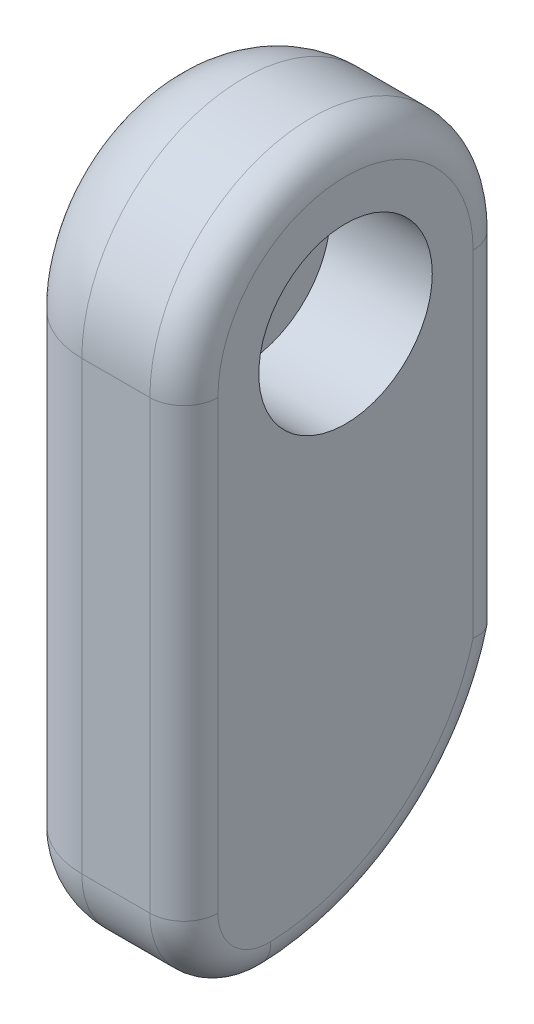
from build123d import *

# Parameters (mm, degrees)
ESBO_O1_R                = 9.5
RESSALTO_EXTRUS_O1_DEPTH = 11
FILETE1_R                = 5
ESBO_O2_R                = 5.1000000000000005
CORTE_EXTRUS_O1_DEPTH    = 6
FILETE2_R                = 5
FILETE4_R                = 2


with BuildPart() as part:
    # Esboço1 → Ressalto-extrusão1 (new body)
    with BuildSketch(Plane(origin=(0, 0, 0), x_dir=(0, 0, -1), z_dir=(1, 0, 0))):
        Circle(ESBO_O1_R)
        with BuildLine():
            Line((9.500000000000002, -20), (9.5, 0))
            ThreePointArc((9.5, -2.33e-15), (-1.75e-15, -9.5), (-9.5, 1.16e-15))
            Line((-9.5, 0), (-9.5, -30.5))
            ThreePointArc((-9.5, -30.5), (2.298839010018332, -29.40980392289032), (9.5, -20))
        make_face()
    extrude(amount=-RESSALTO_EXTRUS_O1_DEPTH)

    # Filete1
    filete1_edges = [part.edges().sort_by_distance(p)[0] for p in [
        (-5.5, -30.5, 9.5),
    ]]
    fillet(filete1_edges, radius=FILETE1_R)

    # Esboço2 → Corte-extrusão1 (cut)
    with BuildSketch(Plane(origin=(0, 0, 0), x_dir=(0, 0, -1), z_dir=(1, 0, 0))):
        Circle(ESBO_O2_R)
    extrude(amount=-CORTE_EXTRUS_O1_DEPTH, mode=Mode.SUBTRACT)

    # Filete2
    # the kernel refuses this fillet: 5 mm, written as the material it takes off along each edge
    with BuildSketch(Plane(origin=(-11, -16.482034889709183, 4.845454403055449), x_dir=(0, -0.9993747520623889, -0.035356823107268454), z_dir=(0, -0.035356823107268454, 0.9993747520623889))) as filete2_piece_1:
        with BuildLine():
            CenterArc((14.770515920148714 - FILETE2_R, FILETE2_R), FILETE2_R, 270, 90)
            Line((14.770515920148714 - FILETE2_R, 0), (14.770515920148714 - FILETE2_R, -FILETE2_R * 0.02))
            Line((14.770515920148714 - FILETE2_R, -FILETE2_R * 0.02), (14.770515920148714 + FILETE2_R * 0.02, -FILETE2_R * 0.02))
            Line((14.770515920148714 + FILETE2_R * 0.02, -FILETE2_R * 0.02), (14.770515920148714 + FILETE2_R * 0.02, FILETE2_R))
            Line((14.770515920148714 + FILETE2_R * 0.02, FILETE2_R), (14.770515920148714, FILETE2_R))
        make_face()
    revolve(axis=Axis((-11, -16.482034889709183, 4.845454403055449), (1, 0, 0)), revolution_arc=93.59555420647537, mode=Mode.SUBTRACT)
    with BuildSketch(Plane(origin=(-11, -25, -9.500000000000002), x_dir=(1, 0, 0), z_dir=(0, 1, 9e-17))) as filete2_piece_2:
        with BuildLine():
            CenterArc((FILETE2_R, -FILETE2_R), FILETE2_R, 90, 90)
            Line((0, -FILETE2_R), (-FILETE2_R * 0.02, -FILETE2_R))
            Line((-FILETE2_R * 0.02, -FILETE2_R), (-FILETE2_R * 0.02, FILETE2_R * 0.02))
            Line((-FILETE2_R * 0.02, FILETE2_R * 0.02), (FILETE2_R, FILETE2_R * 0.02))
            Line((FILETE2_R, FILETE2_R * 0.02), (FILETE2_R, 0))
        make_face()
    extrude(amount=25, mode=Mode.SUBTRACT)
    with BuildSketch(Plane(origin=(-11, -26.246441814929426, 4.5), x_dir=(0, 0, 1), z_dir=(0, 1, 0))) as filete2_piece_3:
        with BuildLine():
            CenterArc((5 - FILETE2_R, FILETE2_R), FILETE2_R, 270, 90)
            Line((5 - FILETE2_R, 0), (5 - FILETE2_R, -FILETE2_R * 0.02))
            Line((5 - FILETE2_R, -FILETE2_R * 0.02), (5, -FILETE2_R * 0.02))
            Line((5, -FILETE2_R * 0.02), (5 + FILETE2_R * 0.02, 0))
            Line((5 + FILETE2_R * 0.02, 0), (5 + FILETE2_R * 0.02, FILETE2_R))
            Line((5 + FILETE2_R * 0.02, FILETE2_R), (5, FILETE2_R))
        make_face()
    revolve(axis=Axis((-11, -26.246441814929426, 4.5), (1, 0, 0)), revolution_arc=92.02621905507084, mode=Mode.SUBTRACT)
    with BuildSketch(Plane(origin=(-11, 0, 0), x_dir=(0, 0, -1), z_dir=(0, -1, 0))) as filete2_piece_4:
        with BuildLine():
            CenterArc((9.5 - FILETE2_R, FILETE2_R), FILETE2_R, 270, 90)
            Line((9.5 - FILETE2_R, 0), (9.5 - FILETE2_R, -FILETE2_R * 0.02))
            Line((9.5 - FILETE2_R, -FILETE2_R * 0.02), (9.5 + FILETE2_R * 0.02, -FILETE2_R * 0.02))
            Line((9.5 + FILETE2_R * 0.02, -FILETE2_R * 0.02), (9.5 + FILETE2_R * 0.02, FILETE2_R))
            Line((9.5 + FILETE2_R * 0.02, FILETE2_R), (9.5, FILETE2_R))
        make_face()
    revolve(axis=Axis((-11, 0, 0), (1, 0, 0)), revolution_arc=180, mode=Mode.SUBTRACT)
    with BuildSketch(Plane(origin=(-11, 0, 9.5), x_dir=(1, 0, 0), z_dir=(0, -1, 0))) as filete2_piece_5:
        with BuildLine():
            CenterArc((FILETE2_R, -FILETE2_R), FILETE2_R, 90, 90)
            Line((0, -FILETE2_R), (-FILETE2_R * 0.02, -FILETE2_R))
            Line((-FILETE2_R * 0.02, -FILETE2_R), (-FILETE2_R * 0.02, FILETE2_R * 0.02))
            Line((-FILETE2_R * 0.02, FILETE2_R * 0.02), (FILETE2_R, FILETE2_R * 0.02))
            Line((FILETE2_R, FILETE2_R * 0.02), (FILETE2_R, 0))
        make_face()
    extrude(amount=26.246441814929426, mode=Mode.SUBTRACT)

    # Filete4
    # the kernel refuses this fillet: 2 mm, written as the material it takes off along each edge
    with BuildSketch(Plane(origin=(0, -26.246441814929426, 4.5), x_dir=(0, 0, 1), z_dir=(0, 1, 0))) as filete4_piece_1:
        with BuildLine():
            CenterArc((5 - FILETE4_R, -FILETE4_R), FILETE4_R, 6.36e-15, 90)
            Line((5, -FILETE4_R), (5, 0))
            Line((5, 0), (5 - FILETE4_R, 0))
        make_face()
    revolve(axis=Axis((0, -26.246441814929426, 4.5), (1, 0, 0)), revolution_arc=92.02621905507084, mode=Mode.SUBTRACT)
    with BuildSketch(Plane(origin=(0, -25, -9.500000000000002), x_dir=(0, -9e-17, 1), z_dir=(0, 1, 9e-17))) as filete4_piece_2:
        with BuildLine():
            CenterArc((FILETE4_R, -FILETE4_R), FILETE4_R, 90, 90)
            Line((0, -FILETE4_R), (0, 0))
            Line((0, 0), (FILETE4_R, 0))
        make_face()
    extrude(amount=25, mode=Mode.SUBTRACT)
    with BuildSketch(Plane(origin=(0, -16.482034889709183, 4.845454403055449), x_dir=(0, -0.9993747520623889, -0.035356823107268454), z_dir=(0, -0.035356823107268454, 0.9993747520623889))) as filete4_piece_3:
        with BuildLine():
            CenterArc((14.770515920148714 - FILETE4_R, -FILETE4_R), FILETE4_R, 6.36e-15, 90)
            Line((14.770515920148714, -FILETE4_R), (14.770515920148714, 0))
            Line((14.770515920148714, 0), (14.770515920148714 - FILETE4_R, 0))
        make_face()
    revolve(axis=Axis((0, -16.482034889709183, 4.845454403055449), (1, 0, 0)), revolution_arc=93.59555420647538, mode=Mode.SUBTRACT)
    with BuildSketch(Plane(origin=(0, 0, 9.5), x_dir=(0, 0, -1), z_dir=(0, -1, 0))) as filete4_piece_4:
        with BuildLine():
            CenterArc((FILETE4_R, -FILETE4_R), FILETE4_R, 90, 90)
            Line((0, -FILETE4_R), (0, 0))
            Line((0, 0), (FILETE4_R, 0))
        make_face()
    extrude(amount=26.246441814929426, mode=Mode.SUBTRACT)
    with BuildSketch(Plane(origin=(0, 0, 0), x_dir=(0, 0, -1), z_dir=(0, -1, 0))) as filete4_piece_5:
        with BuildLine():
            CenterArc((9.5 - FILETE4_R, -FILETE4_R), FILETE4_R, 6.36e-15, 90)
            Line((9.5, -FILETE4_R), (9.5, 0))
            Line((9.5, 0), (9.5 - FILETE4_R, 0))
        make_face()
    revolve(axis=Axis((0, 0, 0), (1, 0, 0)), revolution_arc=180, mode=Mode.SUBTRACT)


solid = part.part
